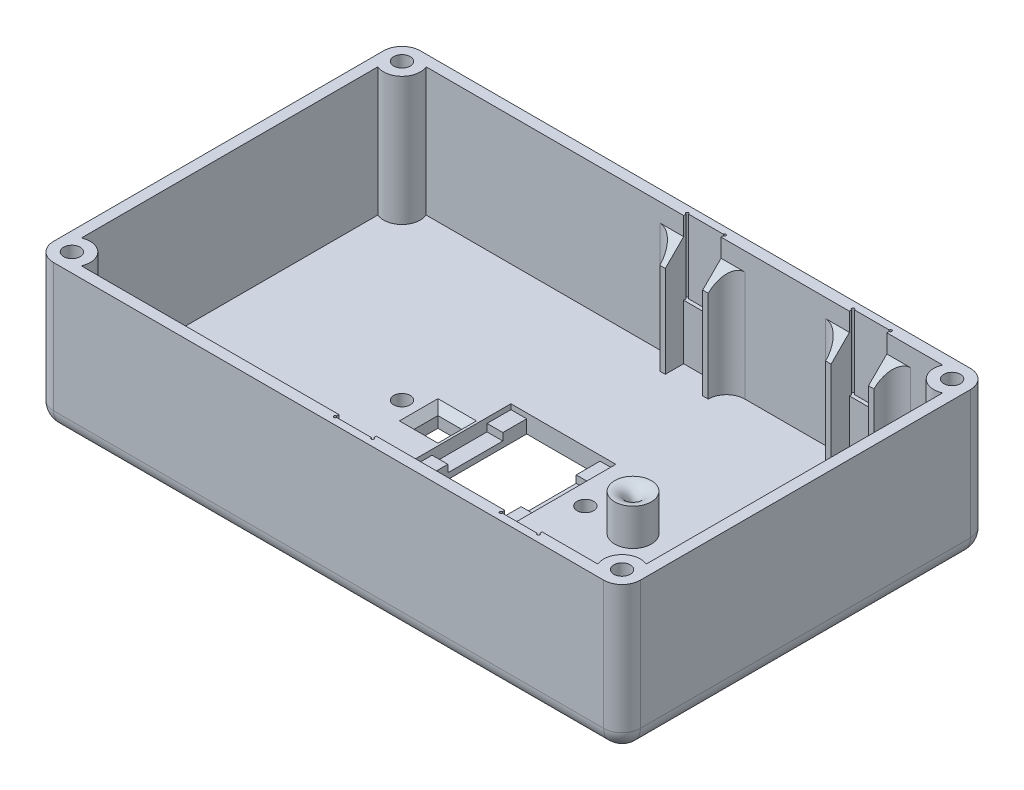
from build123d import *

# Parameters (mm, degrees)
SKETCH1_W                    = 160
SKETCH1_H                    = 100
MAINBODY_DEPTH               = 40
FILLET1_R                    = 5
SHELL1_START                 = 5
SHELL1_DEPTH                 = 35
ROTARYASSEMBLYCUTOUTSKETCH_W = 10.2
ROTARYASSEMBLYCUTOUTSKETCH_H = 20
ROTARYASSEMBLYCUTOUT_DEPTH   = 1
SKETCH5_R                    = 5
SCREWHOLEMATERIAL_DEPTH      = 35
SKETCH6_R                    = 2.25
INSERTHOLE_DEPTH             = 10
SKETCH8_W                    = 20
SKETCH8_H                    = 28
SCREENCUTOUT_DEPTH           = 101.623058987
SKETCH7_W                    = 28.6
SKETCH7_H                    = 28
SCREENCUTOUT1_DEPTH          = 1.4
SKETCH9_W                    = 28.6
SKETCH9_H                    = 15
SCREENCUTOUT2_DEPTH          = 2
SKETCH10_W                   = 6.5
SKETCH10_H                   = 6.5
BUTTONHOLE_DEPTH             = 101.623058987
SKETCH11_R                   = 2.25
HEATINSERTHOLE_DEPTH         = 4.2
SKETCH12_R                   = 5
STRINGSUPPORT_DEPTH          = 10
SKETCH13_R                   = 1
STRINGHOLE_DEPTH             = 98.59610648
FILLET2_R                    = 4
FILLET3_SIZE                 = 8
FILLET3_SIZE_2               = 5
SKETCH14_W                   = 1.5
SKETCH14_H                   = 30
BOSS_EXTRUDE1_DEPTH          = 5
SKETCH15_R                   = 0.5
CUT_EXTRUDE1_DEPTH           = 20
CHAMFER1_SIZE                = 5
FILLET5_R                    = 5
SKETCH17_W                   = 1.5
SKETCH17_H                   = 30
BOSS_EXTRUDE2_DEPTH          = 5
CHAMFER2_SIZE                = 5
FILLET6_R                    = 5
SKETCH16_R                   = 0.5
CUT_EXTRUDE2_DEPTH           = 20
SKETCH18_R                   = 0.375
CUT_EXTRUDE3_DEPTH           = 20
CHAMFER3_SIZE                = 2


# Read off the part's stored shape, not the designer's step: Shell1
# Some blends are built 0.0001 mm under size
with BuildPart() as part:
    # Sketch1 → MainBody (new body)
    with BuildSketch(Plane(origin=(0, 0, 0), x_dir=(1, 0, 0), z_dir=(0, 1, 0))):
        Rectangle(SKETCH1_W, SKETCH1_H)
    extrude(amount=MAINBODY_DEPTH)

    # Fillet1
    fillet1_edges = [part.edges().sort_by_distance(p)[0] for p in [
        (0, 0, -50),
        (80, 0, 0),
        (0, 0, 50),
        (-80, 0, 0),
        (-80, 20, -50),
        (80, 20, -50),
        (80, 20, 50),
        (-80, 20, 50),
    ]]
    fillet(fillet1_edges, radius=FILLET1_R)

    # Shell1 outline → Shell1 (cut)
    with BuildSketch(Plane(origin=(0, 0, 0), x_dir=(1, 0, 0), z_dir=(0, 1, 0)).offset(SHELL1_START)):
        with BuildLine():
            Line((-77, 45), (-77, -45))
            ThreePointArc((-77, -45), (-76.414213562, -46.414213562), (-75, -47))
            Line((-75, -47), (75, -47))
            ThreePointArc((75, -47), (76.414213562, -46.414213562), (77, -45))
            Line((77, -45), (77, 45))
            ThreePointArc((77, 45), (76.414213562, 46.414213562), (75, 47))
            Line((75, 47), (-75, 47))
            ThreePointArc((-75, 47), (-76.414213562, 46.414213562), (-77, 45))
        make_face()
    extrude(amount=SHELL1_DEPTH, mode=Mode.SUBTRACT)

    # RotaryAssemblyCutoutSketch → RotaryAssemblyCutout (cut)
    with BuildSketch(Plane(origin=(0, 0, 47), x_dir=(-1, 0, 0), z_dir=(0, 0, -1))):
        with Locations((-50.1, 30)):
            Rectangle(ROTARYASSEMBLYCUTOUTSKETCH_W, ROTARYASSEMBLYCUTOUTSKETCH_H)
        with Locations((-4.9, 30)):
            Rectangle(ROTARYASSEMBLYCUTOUTSKETCH_W, ROTARYASSEMBLYCUTOUTSKETCH_H)
    rotaryassemblycutout = extrude(amount=-ROTARYASSEMBLYCUTOUT_DEPTH, mode=Mode.SUBTRACT)

    # CutoutMirror: RotaryAssemblyCutout across plane
    add(rotaryassemblycutout.mirror(Plane(origin=(0, 0, 0), x_dir=(1, 0, 0), z_dir=(0, 0, -1))), mode=Mode.SUBTRACT)

    # Sketch5 → ScrewHoleMaterial (add)
    with BuildSketch(Plane(origin=(0, 40, 0), x_dir=(1, 0, 0), z_dir=(0, 1, 0))):
        with Locations((-75, 45)):
            Circle(SKETCH5_R)
        with Locations((-75, -45)):
            Circle(SKETCH5_R)
        with Locations((75, -45)):
            Circle(SKETCH5_R)
        with Locations((75, 45)):
            Circle(SKETCH5_R)
    extrude(amount=-SCREWHOLEMATERIAL_DEPTH)

    # Sketch6 → InsertHole (cut)
    with BuildSketch(Plane(origin=(0, 40, 0), x_dir=(1, 0, 0), z_dir=(0, 1, 0))):
        with Locations(Location((-75, 45, 0), (0, 0, 270))):
            Circle(SKETCH6_R)
        with Locations(Location((-75, -45, 0), (0, 0, 270))):
            Circle(SKETCH6_R)
        with Locations(Location((75, -45, 0), (0, 0, 270))):
            Circle(SKETCH6_R)
        with Locations(Location((75, 45, 0), (0, 0, 270))):
            Circle(SKETCH6_R)
    extrude(amount=-INSERTHOLE_DEPTH, mode=Mode.SUBTRACT)

    # Sketch8 → ScreenCutout (cut, through all)
    with BuildSketch(Plane(origin=(0, 5, 0), x_dir=(1, 0, 0), z_dir=(0, 1, 0))):
        Rectangle(SKETCH8_W, SKETCH8_H)
    extrude(amount=-SCREENCUTOUT_DEPTH, mode=Mode.SUBTRACT)

    # Sketch7 → ScreenCutout1 (cut)
    with BuildSketch(Plane(origin=(0, 5, 0), x_dir=(1, 0, 0), z_dir=(0, 1, 0))):
        Rectangle(SKETCH7_W, SKETCH7_H)
    extrude(amount=-SCREENCUTOUT1_DEPTH, mode=Mode.SUBTRACT)

    # Sketch9 → ScreenCutout2 (cut)
    with BuildSketch(Plane(origin=(0, 3.6, 0), x_dir=(1, 0, 0), z_dir=(0, 1, 0))):
        Rectangle(SKETCH9_W, SKETCH9_H)
    extrude(amount=-SCREENCUTOUT2_DEPTH, mode=Mode.SUBTRACT)

    # Sketch10 → ButtonHole (cut, through all)
    with BuildSketch(Plane(origin=(0, 5, 0), x_dir=(1, 0, 0), z_dir=(0, 1, 0))):
        with Locations((-20.2, 0)):
            Rectangle(SKETCH10_W, SKETCH10_H)
    extrude(amount=-BUTTONHOLE_DEPTH, mode=Mode.SUBTRACT)

    # Sketch11 → HeatInsertHole (cut)
    with BuildSketch(Plane(origin=(0, 5, 0), x_dir=(1, 0, 0), z_dir=(0, 1, 0))):
        with Locations(Location((-30, 0, 0), (0, 0, 270))):
            Circle(SKETCH11_R)
        with Locations(Location((20, 0, 0), (0, 0, 270))):
            Circle(SKETCH11_R)
    extrude(amount=-HEATINSERTHOLE_DEPTH, mode=Mode.SUBTRACT)

    # Sketch12 → StringSupport (add)
    with BuildSketch(Plane(origin=(0, 5, 0), x_dir=(1, 0, 0), z_dir=(0, 1, 0))):
        with Locations(Location((33, 0, 0), (0, 0, 270))):
            Circle(SKETCH12_R)
    extrude(amount=STRINGSUPPORT_DEPTH)

    # Sketch13 → StringHole (cut, through all)
    with BuildSketch(Plane(origin=(0, 15, 0), x_dir=(1, 0, 0), z_dir=(0, 1, 0))):
        with Locations(Location((33, 0, 0), (0, 0, 270))):
            Circle(SKETCH13_R)
    extrude(amount=-STRINGHOLE_DEPTH, mode=Mode.SUBTRACT)

    # Fillet2
    fillet2_edges = [part.edges().sort_by_distance(p)[0] for p in [
        (33, 15, -1),
    ]]
    fillet(fillet2_edges, radius=FILLET2_R - 0.0001)  # a hair under: the kernel refuses the full size

    # Fillet3
    # an asymmetric fillet: 8, 5 mm, written as the material it takes off along each edge
    with BuildSketch(Plane(origin=(33, 0, 0), x_dir=(0, 0, 1), z_dir=(-1, 0, 0))) as fillet3_piece_1:
        with BuildLine():
            Bezier((1, FILLET3_SIZE), (1, 0), (1 + FILLET3_SIZE_2, 0), weights=[1, 0.707106781, 1])
            Line((1 + FILLET3_SIZE_2, 0), (1, 0))
            Line((1, 0), (1, FILLET3_SIZE))
        make_face()
    revolve(axis=Axis((33, 0, 0), (0, 1, 0)), mode=Mode.SUBTRACT)

    # Sketch14 → Boss-Extrude1 (add)
    with BuildSketch(Plane.XY.offset(-47)):
        with Locations((-0.95, 20)):
            Rectangle(SKETCH14_W, SKETCH14_H)
        with Locations((10.75, 20)):
            Rectangle(SKETCH14_W, SKETCH14_H)
    extrude(amount=BOSS_EXTRUDE1_DEPTH)

    # Sketch15 → Cut-Extrude1 (cut)
    with BuildSketch(Plane(origin=(0, 40, 0), x_dir=(1, 0, 0), z_dir=(0, 1, 0))):
        with Locations((-0.2, 48)):
            Circle(SKETCH15_R)
        with Locations((10, 48)):
            Circle(SKETCH15_R)
    extrude(amount=-CUT_EXTRUDE1_DEPTH, mode=Mode.SUBTRACT)

    # Chamfer1
    chamfer1_edges = [part.edges().sort_by_distance(p)[0] for p in [
        (10.75, 35, -42),
        (-0.95, 35, -42),
    ]]
    chamfer(chamfer1_edges, length=CHAMFER1_SIZE - 0.0001)  # a hair under: the kernel refuses the full size

    # Fillet5
    # the kernel refuses this fillet: 5 mm, written as the material it adds along each edge
    with BuildSketch(Plane(origin=(11.5, 5, -47), x_dir=(0, 0, 1), z_dir=(0, 1, 0))) as fillet5_piece_1_section:
        with BuildLine():
            CenterArc((FILLET5_R, FILLET5_R), FILLET5_R, 180, 90)
            Line((0, FILLET5_R), (0, 0))
            Line((0, 0), (FILLET5_R, 0))
        make_face()
    fillet5_piece_1 = extrude(amount=42.5, mode=Mode.PRIVATE)
    fillet5_piece_1 = split(fillet5_piece_1, bisect_by=Plane(origin=(12.655573562, 26.680118084, -38.680018084), z_dir=(0, -0.7071067811865479, -0.7071067811865474)), keep=Keep.TOP, mode=Mode.PRIVATE)
    add(fillet5_piece_1)
    with BuildSketch(Plane(origin=(-1.7, 47.5, -47), x_dir=(-1, 0, 0), z_dir=(0, -1, 0))) as fillet5_piece_2_section:
        with BuildLine():
            CenterArc((FILLET5_R, -FILLET5_R), FILLET5_R, 90, 90)
            Line((0, -FILLET5_R), (0, 0))
            Line((0, 0), (FILLET5_R, 0))
        make_face()
    fillet5_piece_2 = extrude(amount=42.5, mode=Mode.PRIVATE)
    fillet5_piece_2 = split(fillet5_piece_2, bisect_by=Plane(origin=(-4.149999992, 35.05005, -47.04995), z_dir=(0, -0.7071067811865479, -0.7071067811865474)), keep=Keep.TOP, mode=Mode.PRIVATE)
    add(fillet5_piece_2)

    # Sketch17 → Boss-Extrude2 (add)
    with BuildSketch(Plane.XY.offset(-47)):
        with Locations((44.25, 20)):
            Rectangle(SKETCH17_W, SKETCH17_H)
        with Locations((55.95, 20)):
            Rectangle(SKETCH17_W, SKETCH17_H)
    extrude(amount=BOSS_EXTRUDE2_DEPTH)

    # Chamfer2
    chamfer2_edges = [part.edges().sort_by_distance(p)[0] for p in [
        (55.95, 35, -42),
        (44.25, 35, -42),
    ]]
    chamfer(chamfer2_edges, length=CHAMFER2_SIZE - 0.0001)  # a hair under: the kernel refuses the full size

    # Fillet6
    # the kernel refuses this fillet: 5 mm, written as the material it adds along each edge
    with BuildSketch(Plane(origin=(56.7, 47.5, -47), x_dir=(0, 0, 1), z_dir=(0, -1, 0))) as fillet6_piece_1_section:
        with BuildLine():
            CenterArc((FILLET6_R, -FILLET6_R), FILLET6_R, 90, 90)
            Line((0, -FILLET6_R), (0, 0))
            Line((0, 0), (FILLET6_R, 0))
        make_face()
    fillet6_piece_1 = extrude(amount=42.5, mode=Mode.PRIVATE)
    fillet6_piece_1 = split(fillet6_piece_1, bisect_by=Plane(origin=(59.149999992, 35.05005, -47.04995), z_dir=(0, -0.7071067811865479, -0.7071067811865474)), keep=Keep.TOP, mode=Mode.PRIVATE)
    add(fillet6_piece_1)
    with BuildSketch(Plane(origin=(43.5, 47.5, -47), x_dir=(0, 0, 1), z_dir=(0, -1, 0))) as fillet6_piece_2_section:
        with BuildLine():
            CenterArc((FILLET6_R, FILLET6_R), FILLET6_R, 180, 90)
            Line((0, FILLET6_R), (0, 0))
            Line((0, 0), (FILLET6_R, 0))
        make_face()
    fillet6_piece_2 = extrude(amount=42.5, mode=Mode.PRIVATE)
    fillet6_piece_2 = split(fillet6_piece_2, bisect_by=Plane(origin=(41.050000008, 35.05005, -47.04995), z_dir=(0, -0.7071067811865479, -0.7071067811865474)), keep=Keep.TOP, mode=Mode.PRIVATE)
    add(fillet6_piece_2)

    # Sketch16 → Cut-Extrude2 (cut)
    with BuildSketch(Plane(origin=(0, 40, 0), x_dir=(1, 0, 0), z_dir=(0, 1, 0))):
        with Locations((45, 48)):
            Circle(SKETCH16_R)
        with Locations((55.2, 48)):
            Circle(SKETCH16_R)
    extrude(amount=-CUT_EXTRUDE2_DEPTH, mode=Mode.SUBTRACT)

    # Mirror5: part across plane


with BuildPart() as part_1:
    add(part.part)
    add(part.part.mirror(Plane.XY))

    # Sketch18 → Cut-Extrude3 (cut)
    with BuildSketch(Plane(origin=(0, 40, 0), x_dir=(1, 0, 0), z_dir=(0, 1, 0))):
        with Locations((-0.2, 48)):
            Circle(SKETCH18_R)
        with Locations((10, 48)):
            Circle(SKETCH18_R)
        with Locations((45, 48)):
            Circle(SKETCH18_R)
        with Locations((55.2, 48)):
            Circle(SKETCH18_R)
        with Locations((-0.2, -48)):
            Circle(SKETCH18_R)
        with Locations((10, -48)):
            Circle(SKETCH18_R)
        with Locations((45, -48)):
            Circle(SKETCH18_R)
        with Locations((55.2, -48)):
            Circle(SKETCH18_R)
    extrude(amount=-CUT_EXTRUDE3_DEPTH, mode=Mode.SUBTRACT)

    # Chamfer3
    chamfer3_edges = [part_1.edges().sort_by_distance(p)[0] for p in [
        (-23.45, 5, 0),
        (-20.2, 5, 3.25),
        (-16.95, 5, 0),
        (-20.2, 5, -3.25),
    ]]
    chamfer(chamfer3_edges, length=CHAMFER3_SIZE)


solid = part_1.part
